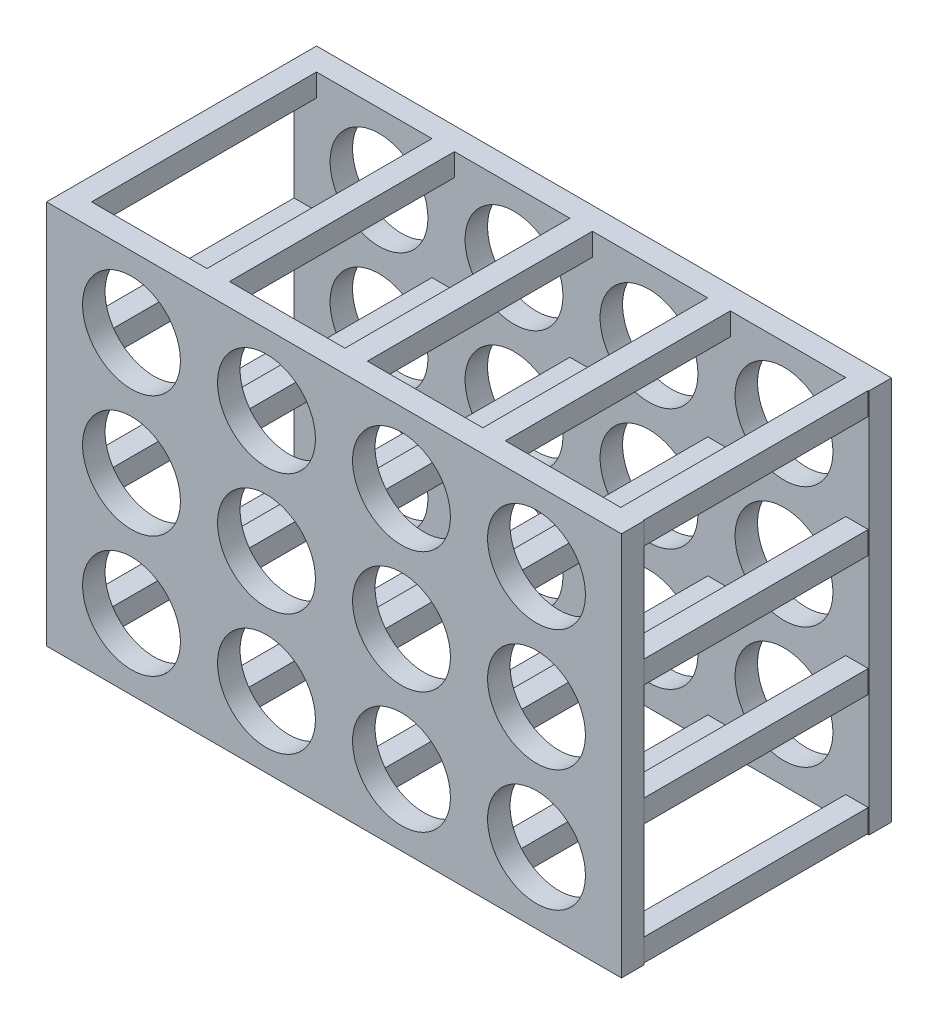
from build123d import *

# Parameters (mm, degrees)
SKETCH1_W                = 127.76
SKETCH1_H                = 85.48
BOSS_EXTRUDE1_DEPTH      = 5
SKETCH2_R                = 10.875
CUT_EXTRUDE1_DEPTH       = 95.825210988
SKETCH3_W                = 5
SKETCH3_H                = 5
BOSS_EXTRUDE2_DEPTH      = 25
LPATTERN2_COUNT          = 4
LPATTERN2_PITCH          = 30
LPATTERN2_COUNT_DIR2     = 3
LPATTERN2_PITCH_DIR2     = 27
LPATTERN3_COUNT          = 5
LPATTERN3_PITCH          = 30.65
LPATTERN3_COUNT_DIR2     = 4
LPATTERN3_PITCH_DIR2     = 26.75
MIRROR5_START            = -54.673764706
MIRROR5_OUTLINE_W        = 5
MIRROR5_OUTLINE_H        = 25
MIRROR5_DEPTH            = 5
MIRROR5_START_2          = -24.023764706
MIRROR5_2_OUTLINE_W      = 5
MIRROR5_2_OUTLINE_H      = 25
MIRROR5_2_DEPTH          = 5
MIRROR5_START_3          = 6.626235294
MIRROR5_3_OUTLINE_W      = 5
MIRROR5_3_OUTLINE_H      = 25
MIRROR5_3_DEPTH          = 5
MIRROR5_START_4          = 37.276235294
MIRROR5_4_OUTLINE_W      = 5
MIRROR5_4_OUTLINE_H      = 25
MIRROR5_4_DEPTH          = 5
MIRROR5_START_5          = 67.926235294
MIRROR5_5_OUTLINE_W      = 5
MIRROR5_5_OUTLINE_H      = 25
MIRROR5_5_DEPTH          = 5
MIRROR6_COPY_1_SKETCH_R  = 10.875
MIRROR6_COPY_1_DEPTH     = 95.825210988
MIRROR6_COPY_2_SKETCH_R  = 10.875
MIRROR6_COPY_2_DEPTH     = 95.825210988
MIRROR6_COPY_3_SKETCH_R  = 10.875
MIRROR6_COPY_3_DEPTH     = 95.825210988
MIRROR6_COPY_4_SKETCH_R  = 10.875
MIRROR6_COPY_4_DEPTH     = 95.825210988
MIRROR6_COPY_5_SKETCH_R  = 10.875
MIRROR6_COPY_5_DEPTH     = 95.825210988
MIRROR6_COPY_6_SKETCH_R  = 10.875
MIRROR6_COPY_6_DEPTH     = 95.825210988
MIRROR6_COPY_7_SKETCH_R  = 10.875
MIRROR6_COPY_7_DEPTH     = 95.825210988
MIRROR6_COPY_8_SKETCH_R  = 10.875
MIRROR6_COPY_8_DEPTH     = 95.825210988
MIRROR6_COPY_9_SKETCH_R  = 10.875
MIRROR6_COPY_9_DEPTH     = 95.825210988
MIRROR6_COPY_10_SKETCH_R = 10.875
MIRROR6_COPY_10_DEPTH    = 95.825210988
MIRROR6_COPY_11_SKETCH_R = 10.875
MIRROR6_COPY_11_DEPTH    = 95.825210988


# Read off the part's stored shape, not the designer's step: Mirror5
with BuildPart() as part:
    # Sketch1 → Boss-Extrude1 (new body)
    with BuildSketch(Plane.XY):
        with Locations((9.206235294, -17.469823529)):
            Rectangle(SKETCH1_W, SKETCH1_H)
    boss_extrude1 = extrude(amount=BOSS_EXTRUDE1_DEPTH)

    # Sketch2 → Cut-Extrude1 (cut, through all)
    with BuildSketch(Plane.XY.offset(5)):
        with Locations((-35.793764706, 9.530176471)):
            Circle(SKETCH2_R)
    cut_extrude1 = extrude(amount=-CUT_EXTRUDE1_DEPTH, mode=Mode.SUBTRACT)

    # Sketch3 → Boss-Extrude2 (add)
    with BuildSketch(Plane.XY.offset(5)):
        with Locations((-52.173764706, 22.770176471)):
            Rectangle(SKETCH3_W, SKETCH3_H)
    boss_extrude2 = extrude(amount=BOSS_EXTRUDE2_DEPTH)

    # LPattern2: Cut-Extrude1 4 × 3
    with Locations(*[(i * LPATTERN2_PITCH, -j * LPATTERN2_PITCH_DIR2, 0) for i in range(LPATTERN2_COUNT) for j in range(LPATTERN2_COUNT_DIR2) if (i, j) != (0, 0)]):
        add(cut_extrude1, mode=Mode.SUBTRACT)

    # LPattern3: Boss-Extrude2 5 × 4
    with Locations(*[(i * LPATTERN3_PITCH, -j * LPATTERN3_PITCH_DIR2, 0) for i in range(LPATTERN3_COUNT) for j in range(LPATTERN3_COUNT_DIR2) if (i, j) != (0, 0)]):
        add(boss_extrude2)

    # Mirror5 outline → Mirror5 (add)
    with BuildSketch(Plane.YZ.offset(MIRROR5_START)):
        with Locations((22.770176471, 42.5)):
            Rectangle(MIRROR5_OUTLINE_W, MIRROR5_OUTLINE_H)
        with Locations((-3.979823529, 42.5)):
            Rectangle(MIRROR5_OUTLINE_W, MIRROR5_OUTLINE_H)
        with Locations((-30.729823529, 42.5)):
            Rectangle(MIRROR5_OUTLINE_W, MIRROR5_OUTLINE_H)
        with Locations((-57.479823529, 42.5)):
            Rectangle(MIRROR5_OUTLINE_W, MIRROR5_OUTLINE_H)
    extrude(amount=MIRROR5_DEPTH)

    # Mirror5 2 outline → Mirror5 2 (add)
    with BuildSketch(Plane.YZ.offset(MIRROR5_START_2)):
        with Locations((22.770176471, 42.5)):
            Rectangle(MIRROR5_2_OUTLINE_W, MIRROR5_2_OUTLINE_H)
        with Locations((-3.979823529, 42.5)):
            Rectangle(MIRROR5_2_OUTLINE_W, MIRROR5_2_OUTLINE_H)
        with Locations((-30.729823529, 42.5)):
            Rectangle(MIRROR5_2_OUTLINE_W, MIRROR5_2_OUTLINE_H)
        with Locations((-57.479823529, 42.5)):
            Rectangle(MIRROR5_2_OUTLINE_W, MIRROR5_2_OUTLINE_H)
    extrude(amount=MIRROR5_2_DEPTH)

    # Mirror5 3 outline → Mirror5 3 (add)
    with BuildSketch(Plane.YZ.offset(MIRROR5_START_3)):
        with Locations((22.770176471, 42.5)):
            Rectangle(MIRROR5_3_OUTLINE_W, MIRROR5_3_OUTLINE_H)
        with Locations((-3.979823529, 42.5)):
            Rectangle(MIRROR5_3_OUTLINE_W, MIRROR5_3_OUTLINE_H)
        with Locations((-30.729823529, 42.5)):
            Rectangle(MIRROR5_3_OUTLINE_W, MIRROR5_3_OUTLINE_H)
        with Locations((-57.479823529, 42.5)):
            Rectangle(MIRROR5_3_OUTLINE_W, MIRROR5_3_OUTLINE_H)
    extrude(amount=MIRROR5_3_DEPTH)

    # Mirror5 4 outline → Mirror5 4 (add)
    with BuildSketch(Plane.YZ.offset(MIRROR5_START_4)):
        with Locations((22.770176471, 42.5)):
            Rectangle(MIRROR5_4_OUTLINE_W, MIRROR5_4_OUTLINE_H)
        with Locations((-3.979823529, 42.5)):
            Rectangle(MIRROR5_4_OUTLINE_W, MIRROR5_4_OUTLINE_H)
        with Locations((-30.729823529, 42.5)):
            Rectangle(MIRROR5_4_OUTLINE_W, MIRROR5_4_OUTLINE_H)
        with Locations((-57.479823529, 42.5)):
            Rectangle(MIRROR5_4_OUTLINE_W, MIRROR5_4_OUTLINE_H)
    extrude(amount=MIRROR5_4_DEPTH)

    # Mirror5 5 outline → Mirror5 5 (add)
    with BuildSketch(Plane.YZ.offset(MIRROR5_START_5)):
        with Locations((22.770176471, 42.5)):
            Rectangle(MIRROR5_5_OUTLINE_W, MIRROR5_5_OUTLINE_H)
        with Locations((-3.979823529, 42.5)):
            Rectangle(MIRROR5_5_OUTLINE_W, MIRROR5_5_OUTLINE_H)
        with Locations((-30.729823529, 42.5)):
            Rectangle(MIRROR5_5_OUTLINE_W, MIRROR5_5_OUTLINE_H)
        with Locations((-57.479823529, 42.5)):
            Rectangle(MIRROR5_5_OUTLINE_W, MIRROR5_5_OUTLINE_H)
    extrude(amount=MIRROR5_5_DEPTH)

    # Mirror6: Boss-Extrude1, Cut-Extrude1 across plane
    add(boss_extrude1.mirror(Plane(origin=(0, 0, 30), x_dir=(1, 0, 0), z_dir=(0, 0, -1))))
    add(cut_extrude1.mirror(Plane(origin=(0, 0, 30), x_dir=(1, 0, 0), z_dir=(0, 0, -1))), mode=Mode.SUBTRACT)

    # Mirror6 copy 1 sketch → Mirror6 copy 1 (cut, through all)
    with BuildSketch(Plane(origin=(0, -27, 55), x_dir=(1, 0, 0), z_dir=(0, 0, -1))):
        with Locations((-35.793764706, -9.530176471)):
            Circle(MIRROR6_COPY_1_SKETCH_R)
    extrude(amount=-MIRROR6_COPY_1_DEPTH, mode=Mode.SUBTRACT)

    # Mirror6 copy 2 sketch → Mirror6 copy 2 (cut, through all)
    with BuildSketch(Plane(origin=(0, -54, 55), x_dir=(1, 0, 0), z_dir=(0, 0, -1))):
        with Locations((-35.793764706, -9.530176471)):
            Circle(MIRROR6_COPY_2_SKETCH_R)
    extrude(amount=-MIRROR6_COPY_2_DEPTH, mode=Mode.SUBTRACT)

    # Mirror6 copy 3 sketch → Mirror6 copy 3 (cut, through all)
    with BuildSketch(Plane(origin=(30, 0, 55), x_dir=(1, 0, 0), z_dir=(0, 0, -1))):
        with Locations((-35.793764706, -9.530176471)):
            Circle(MIRROR6_COPY_3_SKETCH_R)
    extrude(amount=-MIRROR6_COPY_3_DEPTH, mode=Mode.SUBTRACT)

    # Mirror6 copy 4 sketch → Mirror6 copy 4 (cut, through all)
    with BuildSketch(Plane(origin=(30, -27, 55), x_dir=(1, 0, 0), z_dir=(0, 0, -1))):
        with Locations((-35.793764706, -9.530176471)):
            Circle(MIRROR6_COPY_4_SKETCH_R)
    extrude(amount=-MIRROR6_COPY_4_DEPTH, mode=Mode.SUBTRACT)

    # Mirror6 copy 5 sketch → Mirror6 copy 5 (cut, through all)
    with BuildSketch(Plane(origin=(30, -54, 55), x_dir=(1, 0, 0), z_dir=(0, 0, -1))):
        with Locations((-35.793764706, -9.530176471)):
            Circle(MIRROR6_COPY_5_SKETCH_R)
    extrude(amount=-MIRROR6_COPY_5_DEPTH, mode=Mode.SUBTRACT)

    # Mirror6 copy 6 sketch → Mirror6 copy 6 (cut, through all)
    with BuildSketch(Plane(origin=(60, 0, 55), x_dir=(1, 0, 0), z_dir=(0, 0, -1))):
        with Locations((-35.793764706, -9.530176471)):
            Circle(MIRROR6_COPY_6_SKETCH_R)
    extrude(amount=-MIRROR6_COPY_6_DEPTH, mode=Mode.SUBTRACT)

    # Mirror6 copy 7 sketch → Mirror6 copy 7 (cut, through all)
    with BuildSketch(Plane(origin=(60, -27, 55), x_dir=(1, 0, 0), z_dir=(0, 0, -1))):
        with Locations((-35.793764706, -9.530176471)):
            Circle(MIRROR6_COPY_7_SKETCH_R)
    extrude(amount=-MIRROR6_COPY_7_DEPTH, mode=Mode.SUBTRACT)

    # Mirror6 copy 8 sketch → Mirror6 copy 8 (cut, through all)
    with BuildSketch(Plane(origin=(60, -54, 55), x_dir=(1, 0, 0), z_dir=(0, 0, -1))):
        with Locations((-35.793764706, -9.530176471)):
            Circle(MIRROR6_COPY_8_SKETCH_R)
    extrude(amount=-MIRROR6_COPY_8_DEPTH, mode=Mode.SUBTRACT)

    # Mirror6 copy 9 sketch → Mirror6 copy 9 (cut, through all)
    with BuildSketch(Plane(origin=(90, 0, 55), x_dir=(1, 0, 0), z_dir=(0, 0, -1))):
        with Locations((-35.793764706, -9.530176471)):
            Circle(MIRROR6_COPY_9_SKETCH_R)
    extrude(amount=-MIRROR6_COPY_9_DEPTH, mode=Mode.SUBTRACT)

    # Mirror6 copy 10 sketch → Mirror6 copy 10 (cut, through all)
    with BuildSketch(Plane(origin=(90, -27, 55), x_dir=(1, 0, 0), z_dir=(0, 0, -1))):
        with Locations((-35.793764706, -9.530176471)):
            Circle(MIRROR6_COPY_10_SKETCH_R)
    extrude(amount=-MIRROR6_COPY_10_DEPTH, mode=Mode.SUBTRACT)

    # Mirror6 copy 11 sketch → Mirror6 copy 11 (cut, through all)
    with BuildSketch(Plane(origin=(90, -54, 55), x_dir=(1, 0, 0), z_dir=(0, 0, -1))):
        with Locations((-35.793764706, -9.530176471)):
            Circle(MIRROR6_COPY_11_SKETCH_R)
    extrude(amount=-MIRROR6_COPY_11_DEPTH, mode=Mode.SUBTRACT)


solid = part.part
